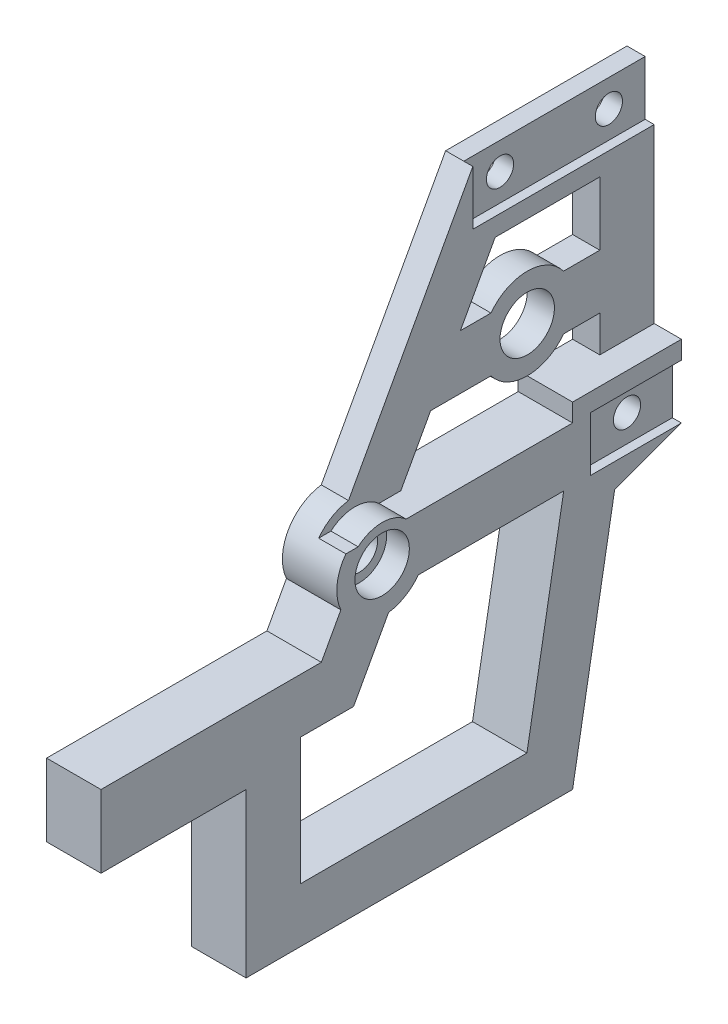
from build123d import *

# Parameters (mm, degrees)
SKETCH1_R                   = 1.5
SKETCH1_R_2                 = 3
SKETCH1_R_3                 = 2
BOSS_EXTRUDE1_DEPTH         = 6
TAP_DRILL_FOR_M3_TAP1_D     = 2.5
TAP_DRILL_FOR_M3_TAP1_DEPTH = 9
TAP_DRILL_FOR_M3_TAP1_TIP   = 0.751075774
CUT_EXTRUDE4_DEPTH          = 3
SKETCH14_W                  = 20
SKETCH14_H                  = 6
CUT_EXTRUDE5_DEPTH          = 1
SKETCH15_W                  = 10
SKETCH15_H                  = 6
CUT_EXTRUDE6_DEPTH          = 1
SKETCH16_R                  = 3
CUT_EXTRUDE7_DEPTH          = 2.5


with BuildPart() as part:
    # Sketch1 → Boss-Extrude1 (new body)
    with BuildSketch(Plane(origin=(0, 0, 0), x_dir=(0, 0, -1), z_dir=(1, 0, 0))):
        with BuildLine():
            Line((52, 0), (56.641211806, 26.321620137))
            Line((56.641211806, 26.321620137), (64, 29))
            Line((64, 29), (64, 62))
            Line((64, 62), (44, 62))
            Line((44, 62), (30.288877114, 36.949172076))
            ThreePointArc((30.288877114, 36.949172076), (26.613988607, 34.400604937), (26.447909215, 29.931553848))
            Line((26.447909215, 29.931553848), (24.296043492, 26))
            Line((24.296043492, 26), (0, 26))
            Line((0, 26), (0, 18))
            Line((0, 18), (16, 18))
            Line((16, 18), (16, 0))
            Line((16, 0), (52, 0))
        make_face()
        with Locations((59, 32)):
            Circle(SKETCH1_R, mode=Mode.SUBTRACT)
        with Locations((50, 44)):
            Circle(SKETCH1_R_2, mode=Mode.SUBTRACT)
        with Locations((60, 59)):
            Circle(SKETCH1_R, mode=Mode.SUBTRACT)
        with Locations((48, 59)):
            Circle(SKETCH1_R, mode=Mode.SUBTRACT)
        with Locations((31, 32)):
            Circle(SKETCH1_R_3, mode=Mode.SUBTRACT)
        with BuildLine():
            Line((39.345952884, 41), (36.061960132, 35))
            Line((36.061960132, 35), (52, 35))
            Line((52, 35), (52, 37))
            Line((52, 37), (58, 37))
            Line((58, 37), (58, 41))
            Line((58, 41), (54, 41))
            ThreePointArc((54, 41), (50, 39), (46, 41))
            Line((46, 41), (39.345952884, 41))
        make_face(mode=Mode.SUBTRACT)
        with BuildLine():
            Line((46.461270512, 54), (42.629945635, 47))
            Line((42.629945635, 47), (46, 47))
            ThreePointArc((46, 47), (50, 49), (54, 47))
            Line((54, 47), (58, 47))
            Line((58, 47), (58, 54))
            Line((58, 54), (46.461270512, 54))
        make_face(mode=Mode.SUBTRACT)
        with BuildLine():
            Line((35, 29), (51.020922769, 29))
            Line((51.020922769, 29), (46.965402213, 6))
            Line((46.965402213, 6), (22, 6))
            Line((22, 6), (22, 20))
            Line((22, 20), (27.851978254, 20))
            Line((27.851978254, 20), (31.711122886, 27.050827924))
            ThreePointArc((31.711122886, 27.050827924), (33.549213145, 27.698661564), (35, 29))
        make_face(mode=Mode.SUBTRACT)
    extrude(amount=BOSS_EXTRUDE1_DEPTH)

    # Tap Drill for M3 Tap1
    with Locations(Plane(origin=(0, 0, 0), x_dir=(-1, 0, 0), z_dir=(0, -1, 0))):
        with Locations((-3, 49), (-3, 19)):
            Hole(TAP_DRILL_FOR_M3_TAP1_D / 2, depth=TAP_DRILL_FOR_M3_TAP1_DEPTH)
            with Locations((0, 0, -(TAP_DRILL_FOR_M3_TAP1_DEPTH + TAP_DRILL_FOR_M3_TAP1_TIP / 2))):  # 118° drill point
                Cone(0, TAP_DRILL_FOR_M3_TAP1_D / 2, TAP_DRILL_FOR_M3_TAP1_TIP, mode=Mode.SUBTRACT)

    # Sketch13 → Cut-Extrude4 (cut)
    with BuildSketch(Plane(origin=(6, 0, 0), x_dir=(0, 0, -1), z_dir=(1, 0, 0))):
        with BuildLine():
            Line((52, 37), (64, 37))
            Line((64, 37), (64, 62))
            Line((64, 62), (44, 62))
            Line((44, 62), (30.288877114, 36.949172076))
            Line((30.288877114, 36.949172076), (27, 36.949172076))
            Line((27, 36.949172076), (27, 35))
            Line((27, 35), (28.354248689, 35))
            ThreePointArc((28.354248689, 35), (31, 36), (33.645751311, 35))
            Line((33.645751311, 35), (52, 35))
            Line((52, 35), (52, 37))
        make_face()
    extrude(amount=-CUT_EXTRUDE4_DEPTH, mode=Mode.SUBTRACT)

    # Sketch14 → Cut-Extrude5 (cut)
    with BuildSketch(Plane(origin=(3, 0, 0), x_dir=(0, 0, -1), z_dir=(1, 0, 0))):
        with Locations((54, 59)):
            Rectangle(SKETCH14_W, SKETCH14_H)
    extrude(amount=-CUT_EXTRUDE5_DEPTH, mode=Mode.SUBTRACT)

    # Sketch15 → Cut-Extrude6 (cut)
    with BuildSketch(Plane(origin=(6, 0, 0), x_dir=(0, 0, -1), z_dir=(1, 0, 0))):
        with Locations((59, 32)):
            Rectangle(SKETCH15_W, SKETCH15_H)
    extrude(amount=-CUT_EXTRUDE6_DEPTH, mode=Mode.SUBTRACT)

    # Sketch16 → Cut-Extrude7 (cut)
    with BuildSketch(Plane(origin=(6, 0, 0), x_dir=(0, 0, -1), z_dir=(1, 0, 0))):
        with Locations((31, 32)):
            Circle(SKETCH16_R)
    extrude(amount=-CUT_EXTRUDE7_DEPTH, mode=Mode.SUBTRACT)


solid = part.part
